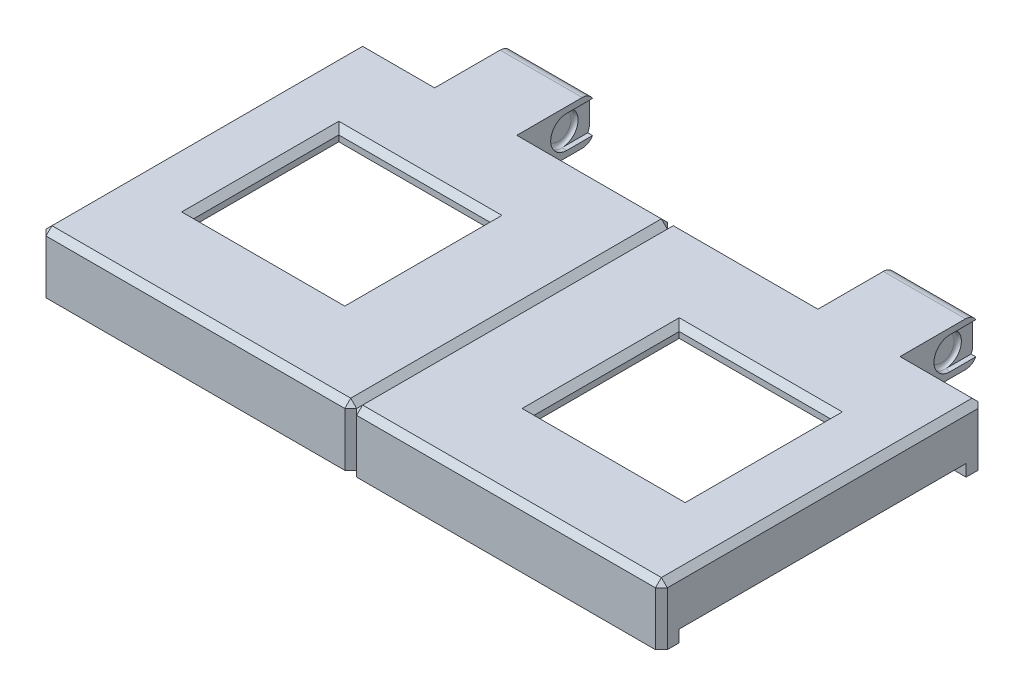
from build123d import *

# Parameters (mm, degrees)
SKETCH1_W            = 26.1
SKETCH1_H            = 27.1
SKETCH1_W_2          = 13
SKETCH1_H_2          = 12.5
BOSS_EXTRUDE1_DEPTH  = 1
BOSS_EXTRUDE2_DEPTH  = 4
SKETCH3_W            = 1
SKETCH3_H            = 24.1
BOSS_EXTRUDE3_DEPTH  = 3
BOSS_EXTRUDE4_DEPTH  = 3
FILLET1_R            = 0.3
BOSS_EXTRUDE5_DEPTH  = 6
FILLET2_R            = 0.3
FILLET2_OF_MIRROR2_R = 0.3
SKETCH8_W            = 13
SKETCH8_H            = 12.5
SKETCH8_W_2          = 12.7
SKETCH8_H_2          = 12.2
BOSS_EXTRUDE6_DEPTH  = 1
SKETCH9_W            = 6
SKETCH9_H            = 3.7
BOSS_EXTRUDE7_DEPTH  = 3.45
SKETCH11_R           = 1.35
CUT_EXTRUDE1_DEPTH   = 0.7
FILLET3_R            = 0.3
CUT_EXTRUDE3_DEPTH   = 0.4
FILLET4_R            = 3
MIRROR3_START        = -2.2
MIRROR3_2_OUTLINE_W  = 0.4
MIRROR3_2_OUTLINE_H  = 2.3
MIRROR3_2_DEPTH      = 2.7
FILLET5_R            = 1
CHAMFER1_SIZE        = 0.5
CHAMFER2_SIZE        = 0.5
CHAMFER4_SIZE        = 0.5


with BuildPart() as part:
    # Sketch1 → Boss-Extrude1 (new body)
    with BuildSketch(Plane(origin=(0, 0, 0), x_dir=(1, 0, 0), z_dir=(0, 1, 0))):
        with Locations((5.25, 6.25)):
            Rectangle(SKETCH1_W, SKETCH1_H)
        with Locations((6.5, 6.25)):
            Rectangle(SKETCH1_W_2, SKETCH1_H_2, mode=Mode.SUBTRACT)
    extrude(amount=BOSS_EXTRUDE1_DEPTH)

    # Sketch2 → Boss-Extrude2 (add)
    with BuildSketch(Plane.XZ):
        Polygon((-7.8, 7.3), (-7.8, -19.8), (18.3, -19.8), (18.3, -18.3), (17.3, -18.3), (17.3, -18.8), (-6.8, -18.8), (-6.8, 6.3), (17.3, 6.3), (17.3, 5.8), (18.3, 5.8), (18.3, 7.3), align=None)
    extrude(amount=BOSS_EXTRUDE2_DEPTH)

    # Sketch3 → Boss-Extrude3 (add)
    with BuildSketch(Plane.XZ):
        with Locations((17.8, -6.25)):
            Rectangle(SKETCH3_W, SKETCH3_H)
    extrude(amount=BOSS_EXTRUDE3_DEPTH)

    # Sketch4 → Boss-Extrude4 (add, symmetric)
    with BuildSketch(Plane.XY.offset(-12.5)):
        Polygon((-6.8, -4), (-6.25, -3.570292905), (-6.8, -3.4), align=None)
    extrude(amount=BOSS_EXTRUDE4_DEPTH, both=True)

    # Fillet1
    # the kernel refuses this fillet: 0.3 mm, written as the material it adds along each edge
    with BuildSketch(Plane(origin=(-6.8, -2.65, -15.5), x_dir=(0, 0, -1), z_dir=(0, -1, 0))) as fillet1_piece_1_section:
        with BuildLine():
            CenterArc((FILLET1_R, FILLET1_R), FILLET1_R, 180, 90)
            Line((0, FILLET1_R), (0, 0))
            Line((0, 0), (FILLET1_R, 0))
        make_face()
    fillet1_piece_1 = extrude(amount=1.35, mode=Mode.PRIVATE)
    fillet1_piece_1 = split(fillet1_piece_1, bisect_by=Plane(origin=(-7.011903145, -3.334389814, -15.5), z_dir=(-0.2957706001702403, -0.9552589973797346, 0)), keep=Keep.TOP, mode=Mode.PRIVATE)
    fillet1_piece_1 = split(fillet1_piece_1, bisect_by=Plane(origin=(-6.145050385, -3.48829728, -15.5), z_dir=(-0.6156614753256621, 0.7880107536067191, 0)), keep=Keep.TOP, mode=Mode.PRIVATE)
    add(fillet1_piece_1)
    with BuildSketch(Plane(origin=(-6.8, -2.65, -9.5), x_dir=(0, 0, 1), z_dir=(0, -1, 0))) as fillet1_piece_2_section:
        with BuildLine():
            CenterArc((FILLET1_R, -FILLET1_R), FILLET1_R, 90, 90)
            Line((0, -FILLET1_R), (0, 0))
            Line((0, 0), (FILLET1_R, 0))
        make_face()
    fillet1_piece_2 = extrude(amount=1.35, mode=Mode.PRIVATE)
    fillet1_piece_2 = split(fillet1_piece_2, bisect_by=Plane(origin=(-7.011903145, -3.334389814, -9.5), z_dir=(-0.2957706001702403, -0.9552589973797346, 0)), keep=Keep.TOP, mode=Mode.PRIVATE)
    fillet1_piece_2 = split(fillet1_piece_2, bisect_by=Plane(origin=(-6.145050385, -3.48829728, -9.5), z_dir=(-0.6156614753256621, 0.7880107536067191, 0)), keep=Keep.TOP, mode=Mode.PRIVATE)
    add(fillet1_piece_2)

    # Sketch6 → Boss-Extrude5 (add)
    with BuildSketch(Plane.ZY.offset(-13)):
        Polygon((-18.8, -4), (-18.25, -3.570292905), (-18.8, -3.4), align=None)
    boss_extrude5 = extrude(amount=BOSS_EXTRUDE5_DEPTH)

    # Fillet2
    fillet2_edges = [part.edges().sort_by_distance(p)[0] for p in [
        (13, -3.7, -18.8),
        (7, -3.7, -18.8),
    ]]
    fillet(fillet2_edges, radius=FILLET2_R)

    # Mirror2: Boss-Extrude5 across plane
    add(boss_extrude5.mirror(Plane(origin=(0, 0, -6.25), x_dir=(1, 0, 0), z_dir=(0, 0, -1))))

    # Fillet2 of Mirror2
    fillet2_of_mirror2_edges = [part.edges().sort_by_distance(p)[0] for p in [
        (13, -3.7, 6.3),
        (7, -3.7, 6.3),
    ]]
    fillet(fillet2_of_mirror2_edges, radius=FILLET2_OF_MIRROR2_R)

    # Sketch8 → Boss-Extrude6 (add)
    with BuildSketch(Plane(origin=(0, 1, 0), x_dir=(1, 0, 0), z_dir=(0, 1, 0))):
        with Locations((6.5, 6.25)):
            Rectangle(SKETCH8_W, SKETCH8_H)
        with Locations((6.5, 6.25)):
            Rectangle(SKETCH8_W_2, SKETCH8_H_2, mode=Mode.SUBTRACT)
    extrude(amount=-BOSS_EXTRUDE6_DEPTH)

    # Sketch9 → Boss-Extrude7 (add, symmetric)
    with BuildSketch(Plane(origin=(8.3, 0, 0), x_dir=(0, 0, -1), z_dir=(1, 0, 0))):
        with Locations((22.8, -0.85)):
            Rectangle(SKETCH9_W, SKETCH9_H)
    extrude(amount=BOSS_EXTRUDE7_DEPTH, both=True)

    # Sketch11 → Cut-Extrude1 (cut)
    with BuildSketch(Plane(origin=(11.75, 0, 0), x_dir=(0, 0, -1), z_dir=(1, 0, 0))):
        with Locations((23.5, -0.85)):
            Circle(SKETCH11_R)
    extrude(amount=-CUT_EXTRUDE1_DEPTH, mode=Mode.SUBTRACT)

    # Fillet3
    fillet3_edges = [part.edges().sort_by_distance(p)[0] for p in [
        (11.05, -0.85, -22.15),
    ]]
    fillet(fillet3_edges, radius=FILLET3_R)

    # Sketch13 → Cut-Extrude3 (cut)
    with BuildSketch(Plane(origin=(11.75, 0, 0), x_dir=(0, 0, -1), z_dir=(1, 0, 0))):
        with BuildLine():
            Line((23.5, -2.2), (25.8, -2.2))
            Line((25.8, -2.2), (25.8, 0.5))
            Line((25.8, 0.5), (23.5, 0.5))
            ThreePointArc((23.5, 0.5), (24.454594155, 0.104594155), (24.85, -0.85))
            ThreePointArc((24.85, -0.85), (24.454594155, -1.804594155), (23.5, -2.2))
        make_face()
    extrude(amount=-CUT_EXTRUDE3_DEPTH, mode=Mode.SUBTRACT)

    # Fillet4
    # the kernel refuses this fillet: 3 mm, written as the material it adds along each edge
    with BuildSketch(Plane(origin=(4.85, -2.7, -19.8), x_dir=(0, 0, -1), z_dir=(1, 0, 0))) as fillet4_piece_1:
        with BuildLine():
            CenterArc((2.471841419, -3), FILLET4_R, 90, 55.481892159)
            Line((0, -1.3), (-0.049436828, -1.266))
            ThreePointArc((-0.049436828, -1.266), (-0.06, -0.65), (-0.06, 0))
            Line((-0.06, 0), (0, 0.06))
            Line((0, 0.06), (2.471841419, 0.06))
            Line((2.471841419, 0.06), (2.471841419, 0))
        make_face()
    extrude(amount=6.9)

    # Mirror3: read off the stored shape, not the designer's step
    # Mirror3 outline → Mirror3 (revolve, cut)
    with BuildSketch(Plane(origin=(0, -0.85, -23.5), x_dir=(0, 1, 0), z_dir=(0, 0, -1))):
        with BuildLine():
            Line((0, 5.55), (0, 4.85))
            Line((0, 4.85), (1.35, 4.85))
            Line((1.35, 4.85), (1.35, 5.25))
            ThreePointArc((1.35, 5.25), (1.262132034, 5.462132034), (1.05, 5.55))
            Line((1.05, 5.55), (0, 5.55))
        make_face()
    revolve(axis=Axis((0, -0.85, -23.5), (1, 0, 0)), mode=Mode.SUBTRACT)

    # Mirror3 2 outline → Mirror3 2 (cut)
    with BuildSketch(Plane(origin=(0, 0, 0), x_dir=(1, 0, 0), z_dir=(0, 1, 0)).offset(MIRROR3_START)):
        with Locations((5.05, 24.65)):
            Rectangle(MIRROR3_2_OUTLINE_W, MIRROR3_2_OUTLINE_H)
    extrude(amount=MIRROR3_2_DEPTH, mode=Mode.SUBTRACT)

    # Fillet5
    fillet5_edges = [part.edges().sort_by_distance(p)[0] for p in [
        (8.3, -2.7, -25.8),
        (8.3, 1, -25.8),
    ]]
    fillet(fillet5_edges, radius=FILLET5_R)

    # Chamfer1
    chamfer1_edges = [part.edges().sort_by_distance(p)[0] for p in [
        (-7.8, 1, -6.25),
        (5.25, 1, 7.3),
        (18.3, -1.5, -19.8),
        (18.3, -1.5, 7.3),
        (-7.8, -1.5, 7.3),
        (-7.8, -1.5, -19.8),
        (6.5, 1, -0.15),
        (12.85, 1, -6.25),
        (6.5, 1, -12.35),
        (0.15, 1, -6.25),
        (18.3, 1, -6.25),
        (15.025, -4, -19.8),
        (-1.475, -4, -19.8),
        (-1.475, 1, -19.8),
        (5.25, 0, -18.8),
    ]]
    chamfer(chamfer1_edges, length=CHAMFER1_SIZE)

    # Chamfer2
    chamfer2_edges = [part.edges().sort_by_distance(p)[0] for p in [
        (14.775, 1, -19.8),
    ]]
    chamfer(chamfer2_edges, length=CHAMFER2_SIZE)

    # Chamfer4
    chamfer4_edges = [part.edges().sort_by_distance(p)[0] for p in [
        (4.85, -1.5, -19.8),
        (11.75, -1.5, -19.8),
    ]]
    chamfer(chamfer4_edges, length=CHAMFER4_SIZE)


with BuildPart() as body_2:
    # Mirror4: mirrored copy
    add(part.part.mirror(Plane.ZY.offset(7.8)))


solid = Compound([part.part, body_2.part])
